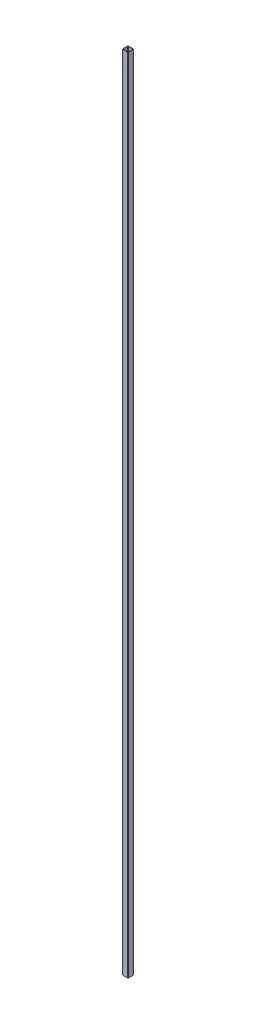
from build123d import *

# Parameters (mm, degrees)
BOSS_EXTRUDE1_DEPTH = 1100


with BuildPart() as part:
    # Sketch1 → Boss-Extrude1 (new body)
    with BuildSketch(Plane(origin=(0, 0, 0), x_dir=(1, 0, 0), z_dir=(0, 1, 0))):
        with BuildLine():
            Line((-3, -4), (3, -4))
            ThreePointArc((3, -4), (3.707106781, -3.707106781), (4, -3))
            Line((4, -3), (4, 3))
            ThreePointArc((4, 3), (3.707106781, 3.707106781), (3, 4))
            Line((3, 4), (-3, 4))
            ThreePointArc((-3, 4), (-3.707106781, 3.707106781), (-4, 3))
            Line((-4, 3), (-4, -3))
            ThreePointArc((-4, -3), (-3.707106781, -3.707106781), (-3, -4))
        make_face()
        with BuildLine():
            Line((-2.5, -3.5), (2.5, -3.5))
            ThreePointArc((2.5, -3.5), (3.207106781, -3.207106781), (3.5, -2.5))
            Line((3.5, -2.5), (3.5, 2.5))
            ThreePointArc((3.5, 2.5), (3.207106781, 3.207106781), (2.5, 3.5))
            Line((2.5, 3.5), (-2.5, 3.5))
            ThreePointArc((-2.5, 3.5), (-3.207106781, 3.207106781), (-3.5, 2.5))
            Line((-3.5, 2.5), (-3.5, -2.5))
            ThreePointArc((-3.5, -2.5), (-3.207106781, -3.207106781), (-2.5, -3.5))
        make_face(mode=Mode.SUBTRACT)
    extrude(amount=BOSS_EXTRUDE1_DEPTH)


solid = part.part
